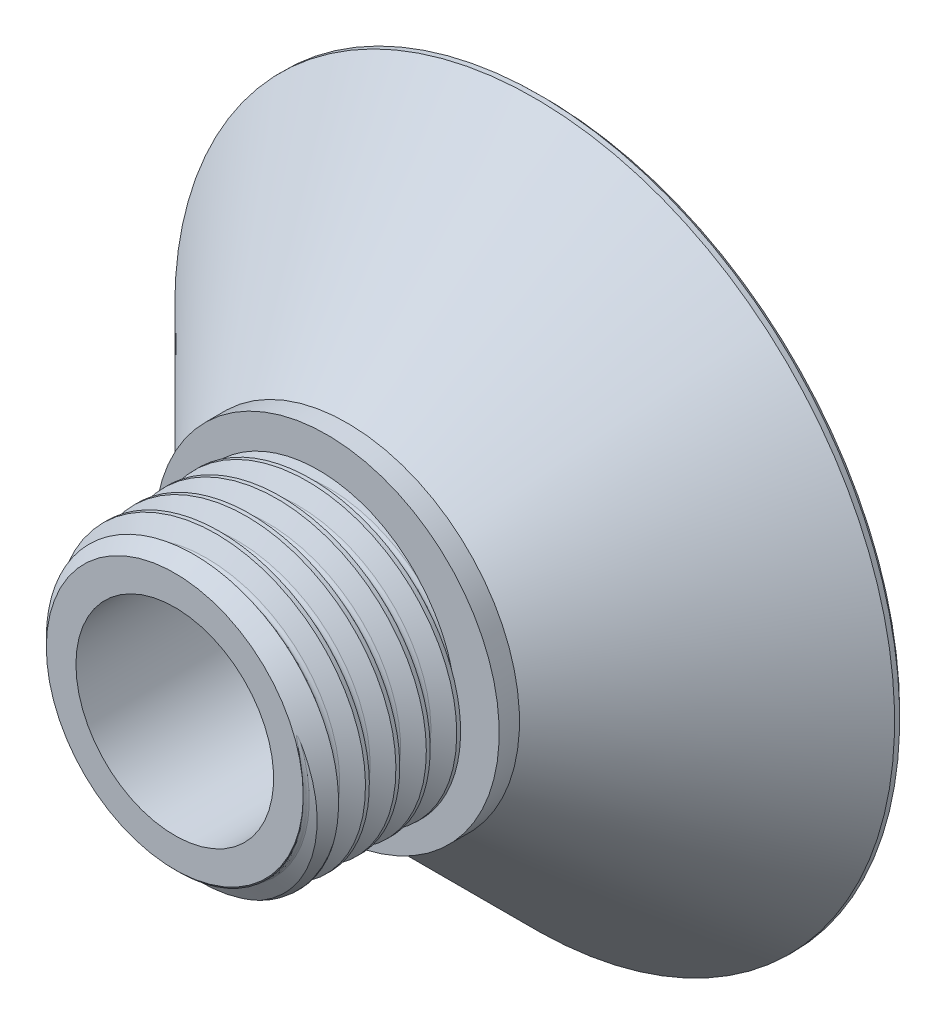
from build123d import *

# Parameters (mm, degrees)
SWEEP5_PITCH            = 3
CUT_EXTRUDE1_DEPTH      = 64.880748335
CUT_EXTRUDE1_DEPTH_BACK = 64.880748335
CHAMFER1_SIZE           = 0.5


with BuildPart() as part:
    # Sketch1 → Revolve1 (revolve)
    with BuildSketch(Plane(origin=(0, 0, 0), x_dir=(0, 0, -1), z_dir=(1, 0, 0)), mode=Mode.PRIVATE) as revolve1_sk:
        Polygon((0, 6.5), (0, 35.5), (-1, 35.5), (-19.5, 17), (-21.5, 17), (-21.5, 12.67), (-36.5, 12.67), (-36.5, 9.75), (-2, 9.75), (-2, 6.5), align=None)
    revolve(revolve1_sk.sketch.rotate(Axis((0, 0, 0), (0, 0, 1)), 90), axis=Axis((0, 0, 0), (0, 0, 1)))

    # Sweep5: arcs per turn and ends read off the stored shape
    # Sweep5: the profile of Sketch4 profile screwed along a right-hand helix through 6 turns, 10 arcs to a turn; built about Z, then put on its axis
    sweep5_z = Axis((0, 0, 0), (0, 0, 1))
    sweep5_corners = [(12.886, 0, -0.374122974), (14.5, 0, -1.305966309), (14.5, 0, -1.684033691), (12.886, 0, -2.615877026), (12.67, 0, -2.99), (12.6697, 0, -2.99), (12.6697, 0, 0), (12.67, 0, 0)]
    with BuildLine(mode=Mode.PRIVATE) as sweep5_profile:
        Line(sweep5_corners[0], sweep5_corners[1])
        Line(sweep5_corners[1], sweep5_corners[2])
        Line(sweep5_corners[2], sweep5_corners[3])
        Line(sweep5_corners[5], sweep5_corners[6])
        Line(sweep5_corners[4], sweep5_corners[5])
        Line(sweep5_corners[7], sweep5_corners[6])
        ThreePointArc((12.886, 0, -2.615877026), (12.727877026, 0, -2.774), (12.67, 0, -2.99))
        ThreePointArc((12.67, 0, 0), (12.727877026, 0, -0.216), (12.886, 0, -0.374122974))
    sweep5_cap = Face(sweep5_profile.wire())
    sweep5_arcs = [((12.886, 0, -2.615877026), (12.67, 0, -2.740584684), (12.67, 0, -2.99), (1, 0.8660254037844132, 1)), ((12.67, 0, 0), (12.67, 0, -0.249415316), (12.886, 0, -0.374122974), (1, 0.8660254037844152, 1))]  # start, shoulder, end, weights
    sweep5_turn_angles = [0, 18, 36, 54, 72, 90, 108, 126, 144, 162, 180, 198, 216, 234, 252, 270, 288, 306, 324, 342, 360]
    sweep5_turn_weights = [1, 0.9510565162951535, 1, 0.9510565162951535, 1, 0.9510565162951535, 1, 0.9510565162951535, 1, 0.9510565162951535, 1, 0.9510565162951535, 1, 0.9510565162951535, 1, 0.9510565162951535, 1, 0.9510565162951535, 1, 0.9510565162951535, 1]
    sweep5_turn_rails = [Edge.make_bspline([Vector(p[0], p[1], 0).rotate(sweep5_z, sweep5_turn_angles[k]) / sweep5_turn_weights[k] + Vector(0, 0, p[2] + SWEEP5_PITCH * sweep5_turn_angles[k] / 360) for k in range(21)], [0, 0, 0, 1, 1, 2, 2, 3, 3, 4, 4, 5, 5, 6, 6, 7, 7, 8, 8, 9, 9, 10, 10, 10], 2, sweep5_turn_weights) for p in sweep5_corners]
    sweep5_turn_sides = [*[Face.make_surface_from_curves(sweep5_turn_rails[p[0]], sweep5_turn_rails[p[1]]) for p in [(0, 1), (1, 2), (2, 3), (5, 6), (4, 5), (7, 6)]], *[Face.make_bezier_surface([[Vector(p[j][0], p[j][1], 0).rotate(sweep5_z, sweep5_turn_angles[2 * i + k]) / sweep5_turn_weights[2 * i + k] + Vector(0, 0, p[j][2] + SWEEP5_PITCH * sweep5_turn_angles[2 * i + k] / 360) for k in range(3)] for j in range(3)], [[p[3][j] * sweep5_turn_weights[2 * i + k] for k in range(3)] for j in range(3)]) for p in sweep5_arcs for i in range(10)]]
    sweep5 = Plane(origin=(0, 0, 21.5), x_dir=(1, 0, 0), z_dir=(0, 0, 1)) * Solid(Shell([*[p.moved(Location((0, 0, SWEEP5_PITCH * i))) for i in range(6) for p in sweep5_turn_sides], sweep5_cap, sweep5_cap.rotate(sweep5_z, 2160).moved(Location((0, 0, SWEEP5_PITCH * 2160 / 360)))]))
    add(sweep5)

    # Sketch11 → Cut-Extrude1 (cut, two sides: drawn at the far end of the back side and taken through both)
    with BuildSketch(Plane(origin=(0, 0, 0), x_dir=(1, 0, 0), z_dir=(0, 1, 0)).offset(-CUT_EXTRUDE1_DEPTH_BACK)):
        Polygon((155.419999662, -36.5), (17.20325686, -36.5), (-17.023158961, -36.5), (-155.239901763, -36.5), (-155.239901763, -312.933485603), (155.419999662, -312.933485603), align=None)
    extrude(amount=CUT_EXTRUDE1_DEPTH + CUT_EXTRUDE1_DEPTH_BACK, mode=Mode.SUBTRACT)

    # Sketch12 → Cut-Revolve1 (revolve, cut)
    with BuildSketch(Plane(origin=(0, 0, 0), x_dir=(1, 0, 0), z_dir=(0, 1, 0))):
        Polygon((12.67, -36.5), (15.17, -34), (15.17, -36.5), align=None)
    revolve(axis=Axis((0, 0, 0), (0, 0, 1)), mode=Mode.SUBTRACT)

    # Chamfer1
    chamfer1_edges = [part.edges().sort_by_distance(p)[0] for p in [
        (35.5, 0, 0),
        (6.5, 0, 0),
    ]]
    chamfer(chamfer1_edges, length=CHAMFER1_SIZE)


solid = part.part
